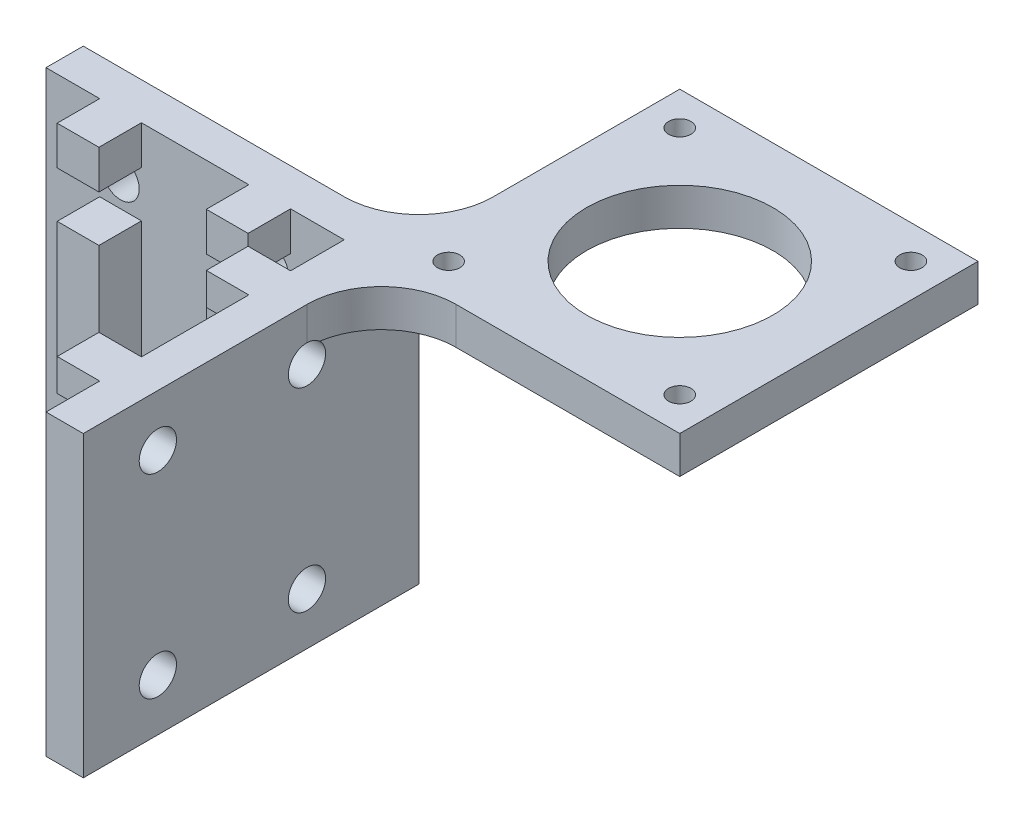
from build123d import *

# Parameters (mm, degrees)
CROQUIS1_W              = 45
CROQUIS1_H              = 40
SALIENTE_EXTRUIR1_DEPTH = 5
CROQUIS2_W              = 5
CROQUIS2_H              = 40
SALIENTE_EXTRUIR2_DEPTH = 40
CROQUIS13_W             = 40
CROQUIS13_H             = 5
SALIENTE_EXTRUIR7_DEPTH = 40
CORTAR_EXTRUIR3_REACH   = 88.783
CROQUIS15_R             = 12.5
CORTAR_EXTRUIR4_REACH   = 88.783
CROQUIS18_R             = 1.5
CROQUIS24_W             = 5.6
CROQUIS24_H             = 5.7
CROQUIS24_W_2           = 5.7
CROQUIS24_H_2           = 5.6
SALIENTE_EXTRUIR8_DEPTH = 40
CROQUIS20_W             = 40
CROQUIS20_H             = 6.2
CORTAR_EXTRUIR5_DEPTH   = 5.7
CROQUIS21_W             = 40
CROQUIS21_H             = 6.2
CORTAR_EXTRUIR6_DEPTH   = 5.7
CORTAR_EXTRUIR7_REACH   = 68.708
CROQUIS22_R             = 2.5
CORTAR_EXTRUIR8_REACH   = 78.852
CROQUIS23_R             = 2.5
REDONDEO1_R             = 10
REDONDEO2_R             = 10


with BuildPart() as part:
    # Croquis1 → Saliente-Extruir1 (new body)
    with BuildSketch(Plane.XY):
        Rectangle(CROQUIS1_W, CROQUIS1_H)
    extrude(amount=SALIENTE_EXTRUIR1_DEPTH)

    # Croquis2 → Saliente-Extruir2 (add)
    with BuildSketch(Plane.XY.offset(5)):
        with Locations((20, 0)):
            Rectangle(CROQUIS2_W, CROQUIS2_H)
    extrude(amount=SALIENTE_EXTRUIR2_DEPTH)

    # Croquis13 → Saliente-Extruir7 (add)
    with BuildSketch(Plane(origin=(22.5, 0, 0), x_dir=(0, 0, -1), z_dir=(1, 0, 0))):
        with Locations((15, 17.5)):
            Rectangle(CROQUIS13_W, CROQUIS13_H)
    extrude(amount=SALIENTE_EXTRUIR7_DEPTH)

    # Croquis15 → Cortar-Extruir3 (cut, up to next)
    with BuildSketch(Plane(origin=(0, 20, 0), x_dir=(1, 0, 0), z_dir=(0, 1, 0)), mode=Mode.PRIVATE) as cortar_extruir3_sk1:
        with Locations(Location((42.5, 15, 0), (0, 0, 180))):
            Circle(CROQUIS15_R)
    cortar_extruir3_tool1 = extrude(cortar_extruir3_sk1.sketch, amount=-CORTAR_EXTRUIR3_REACH, mode=Mode.PRIVATE) & part.part
    add(cortar_extruir3_tool1.solids().sort_by_distance((42.5, 20, -15))[0], mode=Mode.SUBTRACT)

    # Croquis18 → Cortar-Extruir4 (cut, up to next)
    with BuildSketch(Plane(origin=(0, 20, 0), x_dir=(1, 0, 0), z_dir=(0, 1, 0)), mode=Mode.PRIVATE) as cortar_extruir4_sk1:
        with Locations(Location((27, 30.5, 0), (0, 0, 180))):
            Circle(CROQUIS18_R)
    cortar_extruir4_tool1 = extrude(cortar_extruir4_sk1.sketch, amount=-CORTAR_EXTRUIR4_REACH, mode=Mode.PRIVATE) & part.part
    # Croquis18 → Cortar-Extruir4 (cut, up to next)
    with BuildSketch(Plane(origin=(0, 20, 0), x_dir=(1, 0, 0), z_dir=(0, 1, 0)), mode=Mode.PRIVATE) as cortar_extruir4_sk2:
        with Locations(Location((58, 30.5, 0), (0, 0, 180))):
            Circle(CROQUIS18_R)
    cortar_extruir4_tool2 = extrude(cortar_extruir4_sk2.sketch, amount=-CORTAR_EXTRUIR4_REACH, mode=Mode.PRIVATE) & part.part
    # Croquis18 → Cortar-Extruir4 (cut, up to next)
    with BuildSketch(Plane(origin=(0, 20, 0), x_dir=(1, 0, 0), z_dir=(0, 1, 0)), mode=Mode.PRIVATE) as cortar_extruir4_sk3:
        with Locations(Location((58, -0.5, 0), (0, 0, 180))):
            Circle(CROQUIS18_R)
    cortar_extruir4_tool3 = extrude(cortar_extruir4_sk3.sketch, amount=-CORTAR_EXTRUIR4_REACH, mode=Mode.PRIVATE) & part.part
    # Croquis18 → Cortar-Extruir4 (cut, up to next)
    with BuildSketch(Plane(origin=(0, 20, 0), x_dir=(1, 0, 0), z_dir=(0, 1, 0)), mode=Mode.PRIVATE) as cortar_extruir4_sk4:
        with Locations(Location((27, -0.5, 0), (0, 0, 180))):
            Circle(CROQUIS18_R)
    cortar_extruir4_tool4 = extrude(cortar_extruir4_sk4.sketch, amount=-CORTAR_EXTRUIR4_REACH, mode=Mode.PRIVATE) & part.part
    add(cortar_extruir4_tool1.solids().sort_by_distance((27, 20, -30.5))[0], mode=Mode.SUBTRACT)
    add(cortar_extruir4_tool2.solids().sort_by_distance((58, 20, -30.5))[0], mode=Mode.SUBTRACT)
    add(cortar_extruir4_tool3.solids().sort_by_distance((58, 20, 0.5))[0], mode=Mode.SUBTRACT)
    add(cortar_extruir4_tool4.solids().sort_by_distance((27, 20, 0.5))[0], mode=Mode.SUBTRACT)

    # Croquis24 → Saliente-Extruir8 (add)
    with BuildSketch(Plane(origin=(0, -20, 0), x_dir=(-1, 0, 0), z_dir=(0, -1, 0))):
        with Locations((12.5, -7.85)):
            Rectangle(CROQUIS24_W, CROQUIS24_H)
        with Locations((-7.5, -7.85)):
            Rectangle(CROQUIS24_W, CROQUIS24_H)
        with Locations((-14.65, -35)):
            Rectangle(CROQUIS24_W_2, CROQUIS24_H_2)
        with Locations((-14.65, -15)):
            Rectangle(CROQUIS24_W_2, CROQUIS24_H_2)
    extrude(amount=-SALIENTE_EXTRUIR8_DEPTH)

    # Croquis20 → Cortar-Extruir5 (cut)
    with BuildSketch(Plane.ZY.offset(-11.8)):
        with Locations((25, -12.6)):
            Rectangle(CROQUIS20_W, CROQUIS20_H)
        with Locations((25, 12.6)):
            Rectangle(CROQUIS20_W, CROQUIS20_H)
    extrude(amount=-CORTAR_EXTRUIR5_DEPTH, mode=Mode.SUBTRACT)

    # Croquis21 → Cortar-Extruir6 (cut)
    with BuildSketch(Plane.XY.offset(10.7)):
        with Locations((-2.5, -12.6)):
            Rectangle(CROQUIS21_W, CROQUIS21_H)
        with Locations((-2.5, 11.7)):
            Rectangle(CROQUIS21_W, CROQUIS21_H)
    extrude(amount=-CORTAR_EXTRUIR6_DEPTH, mode=Mode.SUBTRACT)

    # Croquis22 → Cortar-Extruir7 (cut, up to next)
    with BuildSketch(Plane.ZY.offset(-17.5), mode=Mode.PRIVATE) as cortar_extruir7_sk1:
        with Locations(Location((15, 13.05, 0), (0, 0, 270))):
            Circle(CROQUIS22_R)
    cortar_extruir7_tool1 = extrude(cortar_extruir7_sk1.sketch, amount=-CORTAR_EXTRUIR7_REACH, mode=Mode.PRIVATE) & part.part
    # Croquis22 → Cortar-Extruir7 (cut, up to next)
    with BuildSketch(Plane.ZY.offset(-17.5), mode=Mode.PRIVATE) as cortar_extruir7_sk2:
        with Locations(Location((35, 13.05, 0), (0, 0, 270))):
            Circle(CROQUIS22_R)
    cortar_extruir7_tool2 = extrude(cortar_extruir7_sk2.sketch, amount=-CORTAR_EXTRUIR7_REACH, mode=Mode.PRIVATE) & part.part
    # Croquis22 → Cortar-Extruir7 (cut, up to next)
    with BuildSketch(Plane.ZY.offset(-17.5), mode=Mode.PRIVATE) as cortar_extruir7_sk3:
        with Locations(Location((15, -13.05, 0), (0, 0, 270))):
            Circle(CROQUIS22_R)
    cortar_extruir7_tool3 = extrude(cortar_extruir7_sk3.sketch, amount=-CORTAR_EXTRUIR7_REACH, mode=Mode.PRIVATE) & part.part
    # Croquis22 → Cortar-Extruir7 (cut, up to next)
    with BuildSketch(Plane.ZY.offset(-17.5), mode=Mode.PRIVATE) as cortar_extruir7_sk4:
        with Locations(Location((35, -13.05, 0), (0, 0, 270))):
            Circle(CROQUIS22_R)
    cortar_extruir7_tool4 = extrude(cortar_extruir7_sk4.sketch, amount=-CORTAR_EXTRUIR7_REACH, mode=Mode.PRIVATE) & part.part
    add(cortar_extruir7_tool1.solids().sort_by_distance((17.5, 13.05, 15))[0], mode=Mode.SUBTRACT)
    add(cortar_extruir7_tool2.solids().sort_by_distance((17.5, 13.05, 35))[0], mode=Mode.SUBTRACT)
    add(cortar_extruir7_tool3.solids().sort_by_distance((17.5, -13.05, 15))[0], mode=Mode.SUBTRACT)
    add(cortar_extruir7_tool4.solids().sort_by_distance((17.5, -13.05, 35))[0], mode=Mode.SUBTRACT)

    # Croquis23 → Cortar-Extruir8 (cut, up to next)
    with BuildSketch(Plane.XY.offset(5), mode=Mode.PRIVATE) as cortar_extruir8_sk1:
        with Locations((-12.5, 12.15)):
            Circle(CROQUIS23_R)
    cortar_extruir8_tool1 = extrude(cortar_extruir8_sk1.sketch, amount=-CORTAR_EXTRUIR8_REACH, mode=Mode.PRIVATE) & part.part
    # Croquis23 → Cortar-Extruir8 (cut, up to next)
    with BuildSketch(Plane.XY.offset(5), mode=Mode.PRIVATE) as cortar_extruir8_sk2:
        with Locations((7.5, 12.15)):
            Circle(CROQUIS23_R)
    cortar_extruir8_tool2 = extrude(cortar_extruir8_sk2.sketch, amount=-CORTAR_EXTRUIR8_REACH, mode=Mode.PRIVATE) & part.part
    # Croquis23 → Cortar-Extruir8 (cut, up to next)
    with BuildSketch(Plane.XY.offset(5), mode=Mode.PRIVATE) as cortar_extruir8_sk3:
        with Locations((-12.5, -13.05)):
            Circle(CROQUIS23_R)
    cortar_extruir8_tool3 = extrude(cortar_extruir8_sk3.sketch, amount=-CORTAR_EXTRUIR8_REACH, mode=Mode.PRIVATE) & part.part
    # Croquis23 → Cortar-Extruir8 (cut, up to next)
    with BuildSketch(Plane.XY.offset(5), mode=Mode.PRIVATE) as cortar_extruir8_sk4:
        with Locations((7.5, -13.05)):
            Circle(CROQUIS23_R)
    cortar_extruir8_tool4 = extrude(cortar_extruir8_sk4.sketch, amount=-CORTAR_EXTRUIR8_REACH, mode=Mode.PRIVATE) & part.part
    add(cortar_extruir8_tool1.solids().sort_by_distance((-12.5, 12.15, 5))[0], mode=Mode.SUBTRACT)
    add(cortar_extruir8_tool2.solids().sort_by_distance((7.5, 12.15, 5))[0], mode=Mode.SUBTRACT)
    add(cortar_extruir8_tool3.solids().sort_by_distance((-12.5, -13.05, 5))[0], mode=Mode.SUBTRACT)
    add(cortar_extruir8_tool4.solids().sort_by_distance((7.5, -13.05, 5))[0], mode=Mode.SUBTRACT)

    # Redondeo1
    # the kernel refuses this fillet: 10 mm, written as the material it adds along each edge
    with BuildSketch(Plane(origin=(22.5, 20, 5), x_dir=(0, 0, 1), z_dir=(0, -1, 0))) as redondeo1_piece_1_section:
        with BuildLine():
            CenterArc((REDONDEO1_R, -REDONDEO1_R), REDONDEO1_R, 90, 90)
            Line((0, -REDONDEO1_R), (0, 0))
            Line((0, 0), (REDONDEO1_R, 0))
        make_face()
    redondeo1_piece_1 = extrude(amount=5, mode=Mode.PRIVATE)
    redondeo1_piece_1 = redondeo1_piece_1 - Plane(origin=(24.766392733, 13.05, 15), x_dir=(0, -1, 0), z_dir=(-1, 0, 0)) * Cylinder(2.5, 50, mode=Mode.PRIVATE)
    add(redondeo1_piece_1)

    # Redondeo2
    redondeo2_edges = [part.edges().sort_by_distance(p)[0] for p in [
        (22.5, 17.5, 0),
    ]]
    fillet(redondeo2_edges, radius=REDONDEO2_R)


solid = part.part
